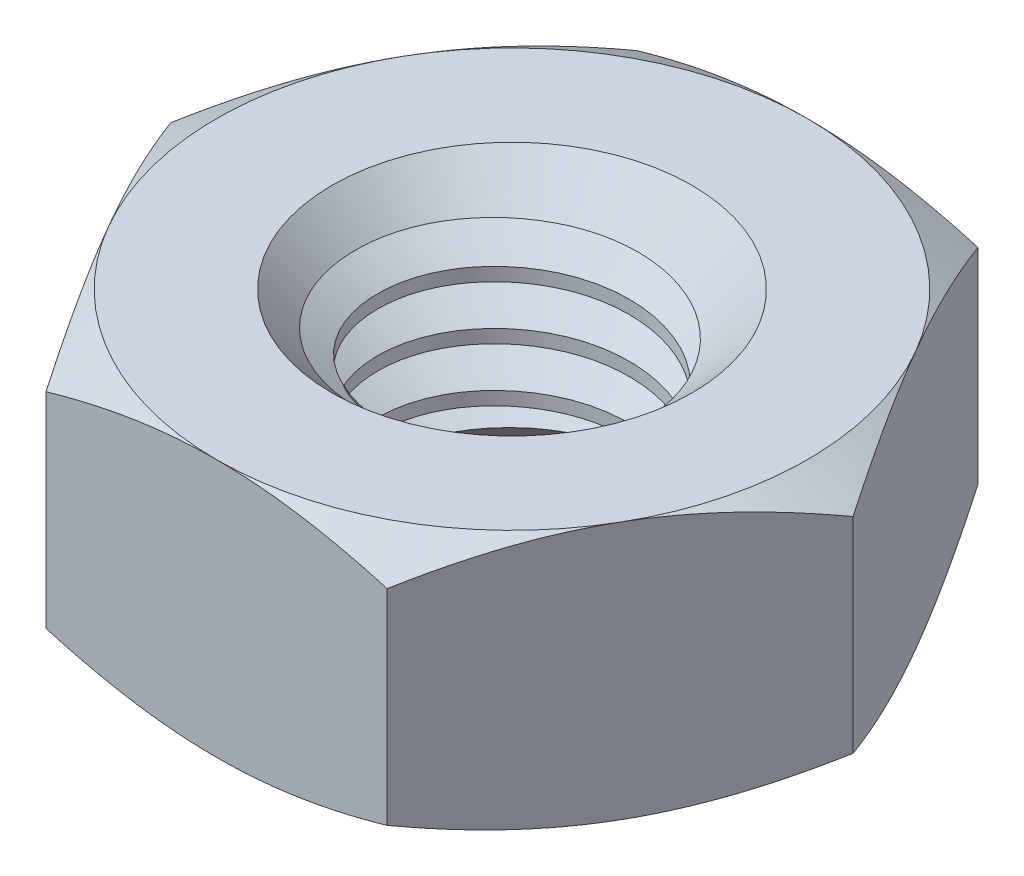
from build123d import *

# Parameters (mm, degrees)
Y_KSEKLIK_EKSTR_ZYON1_DEPTH = 2.4
IZIM2_OUTSIDE_W             = 18.412
IZIM2_OUTSIDE_H             = 17.562
IZIM2_OUTSIDE_R             = 2.75
KES_EKSTR_ZYON1_DEPTH       = 2.4
KES_EKSTR_ZYON1_DRAFT       = -60
IZIM3_OUTSIDE_W             = 18.412
IZIM3_OUTSIDE_H             = 17.562
IZIM3_OUTSIDE_R             = 2.75
KES_EKSTR_ZYON2_DEPTH       = 2.4
KES_EKSTR_ZYON2_DRAFT       = -60
IZIM4_R                     = 1.175
KES_EKSTR_ZYON3_DEPTH       = 2.4
PAH1_SIZE                   = 0.5
KES_S_P_R1_PITCH            = 0.5
BODY_MOVE_COPY1_ANGLE       = 90


with BuildPart() as part:
    # Çizim1 → Yükseklik-Ekstrüzyon1 (new body)
    with BuildSketch(Plane.XY):
        Polygon((3.175426481, 0), (1.58771324, 2.75), (-1.58771324, 2.75), (-3.175426481, 0), (-1.58771324, -2.75), (1.58771324, -2.75), align=None)
    extrude(amount=Y_KSEKLIK_EKSTR_ZYON1_DEPTH)


with BuildPart() as kes_ekstr_zyon1_tool:
    # Çizim2 outside → Kes-Ekstrüzyon1 (with draft: the straight prism first)
    with BuildSketch(Plane.XY.offset(2.4)):
        Rectangle(IZIM2_OUTSIDE_W, IZIM2_OUTSIDE_H)
        Circle(IZIM2_OUTSIDE_R, mode=Mode.SUBTRACT)
    extrude(amount=-KES_EKSTR_ZYON1_DEPTH)
    # Kes-Ekstrüzyon1: the draft: its side faces are tilted about the plane it starts from
    kes_ekstr_zyon1_sides = [kes_ekstr_zyon1_tool.faces().sort_by_distance(p)[0] for p in [
        (0, -8.781, 1.2),
        (9.206, 0, 1.2),
        (0, 8.781, 1.2),
        (-9.206, 0, 1.2),
        (-2.75, 0, 1.2),
    ]]
    draft(kes_ekstr_zyon1_sides, Plane.XY.offset(2.4), KES_EKSTR_ZYON1_DRAFT)


with BuildPart() as part_1:
    add(part.part)

    # Kes-Ekstrüzyon1: cut by kes_ekstr_zyon1_tool
    add(kes_ekstr_zyon1_tool.part, mode=Mode.SUBTRACT)


with BuildPart() as kes_ekstr_zyon2_tool:
    # Çizim3 outside → Kes-Ekstrüzyon2 (with draft: the straight prism first)
    with BuildSketch(Plane(origin=(0, 0, 0), x_dir=(-1, 0, 0), z_dir=(0, 0, -1))):
        Rectangle(IZIM3_OUTSIDE_W, IZIM3_OUTSIDE_H)
        Circle(IZIM3_OUTSIDE_R, mode=Mode.SUBTRACT)
    extrude(amount=-KES_EKSTR_ZYON2_DEPTH)
    # Kes-Ekstrüzyon2: the draft: its side faces are tilted about the plane it starts from
    kes_ekstr_zyon2_sides = [kes_ekstr_zyon2_tool.faces().sort_by_distance(p)[0] for p in [
        (0, -8.781, 1.2),
        (-9.206, 0, 1.2),
        (0, 8.781, 1.2),
        (9.206, 0, 1.2),
        (2.75, 0, 1.2),
    ]]
    draft(kes_ekstr_zyon2_sides, Plane(origin=(0, 0, 0), x_dir=(-1, 0, 0), z_dir=(0, 0, -1)), KES_EKSTR_ZYON2_DRAFT)


with BuildPart() as part_2:
    add(part_1.part)

    # Kes-Ekstrüzyon2: cut by kes_ekstr_zyon2_tool
    add(kes_ekstr_zyon2_tool.part, mode=Mode.SUBTRACT)

    # Çizim4 → Kes-Ekstrüzyon3 (cut)
    with BuildSketch(Plane(origin=(0, 0, 0), x_dir=(-1, 0, 0), z_dir=(0, 0, -1))):
        Circle(IZIM4_R)
    extrude(amount=-KES_EKSTR_ZYON3_DEPTH, mode=Mode.SUBTRACT)

    # Pah1
    pah1_edges = [part_2.edges().sort_by_distance(p)[0] for p in [
        (1.175, 0, 2.4),
        (1.175, 0, 0),
    ]]
    chamfer(pah1_edges, length=PAH1_SIZE)

    # Kes-Süpür1: arcs per turn and ends read off the stored shape
    # Kes-Süpür1: the profile of Çizim6 screwed along a right-hand helix through 6 turns, 6 arcs to a turn; built about Z, then put on its axis
    kes_s_p_r1_z = Axis((0, 0, 0), (0, 0, 1))
    kes_s_p_r1_corners = [(1.5, 0, 0), (1.076270501, 0.016530524, -0.244081212), (1.076270501, -0.016530524, 0.244081212)]
    with BuildLine(mode=Mode.PRIVATE) as kes_s_p_r1_profile:
        Line(kes_s_p_r1_corners[0], kes_s_p_r1_corners[1])
        Line(kes_s_p_r1_corners[1], kes_s_p_r1_corners[2])
        Line(kes_s_p_r1_corners[2], kes_s_p_r1_corners[0])
    kes_s_p_r1_cap = Face(kes_s_p_r1_profile.wire())
    kes_s_p_r1_turn_angles = [0, 30, 60, 90, 120, 150, 180, 210, 240, 270, 300, 330, 360]
    kes_s_p_r1_turn_weights = [1, 0.8660254037844387, 1, 0.8660254037844387, 1, 0.8660254037844387, 1, 0.8660254037844387, 1, 0.8660254037844387, 1, 0.8660254037844387, 1]
    kes_s_p_r1_turn_rails = [Edge.make_bspline([Vector(p[0], p[1], 0).rotate(kes_s_p_r1_z, kes_s_p_r1_turn_angles[k]) / kes_s_p_r1_turn_weights[k] + Vector(0, 0, p[2] + KES_S_P_R1_PITCH * kes_s_p_r1_turn_angles[k] / 360) for k in range(13)], [0, 0, 0, 1, 1, 2, 2, 3, 3, 4, 4, 5, 5, 6, 6, 6], 2, kes_s_p_r1_turn_weights) for p in kes_s_p_r1_corners]
    kes_s_p_r1_turn_sides = [Face.make_surface_from_curves(kes_s_p_r1_turn_rails[p[0]], kes_s_p_r1_turn_rails[p[1]]) for p in [(0, 1), (1, 2), (2, 0)]]
    kes_s_p_r1 = Plane(origin=(0, 0, 2.4), x_dir=(-1, 0, 0), z_dir=(0, 0, -1)) * Solid(Shell([*[p.moved(Location((0, 0, KES_S_P_R1_PITCH * i))) for i in range(6) for p in kes_s_p_r1_turn_sides], kes_s_p_r1_cap, kes_s_p_r1_cap.rotate(kes_s_p_r1_z, 2160).moved(Location((0, 0, KES_S_P_R1_PITCH * 2160 / 360)))]))
    add(kes_s_p_r1, mode=Mode.SUBTRACT)


with BuildPart() as part_3:
    # Body-Move/Copy1: moved
    add(part_2.part.rotate(Axis((0, 0, 1.1993202), (1, 0, 0)), BODY_MOVE_COPY1_ANGLE))


solid = part_3.part
